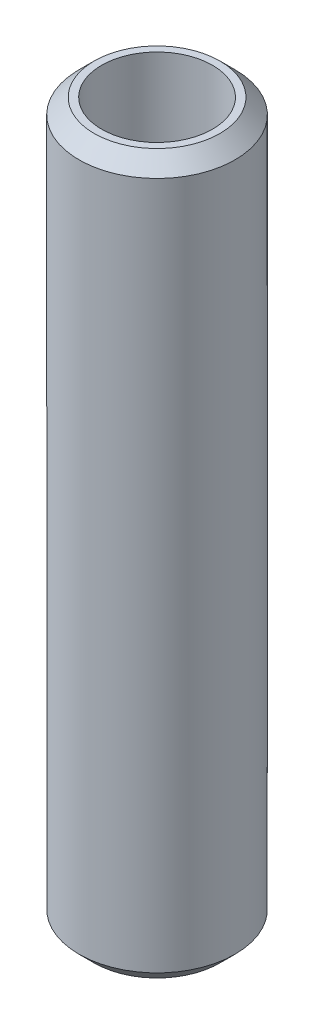
from build123d import *

# Parameters (mm, degrees)
SKETCH1_R           = 15
BOSS_EXTRUDE1_DEPTH = 138.051908772
SKETCH2_R           = 10.65749531
CUT_EXTRUDE1_DEPTH  = 140.672221703
CHAMFER1_SIZE       = 2.919359512


with BuildPart() as part:
    # Sketch1 → Boss-Extrude1 (new body)
    with BuildSketch(Plane(origin=(0, 0, 0), x_dir=(1, 0, 0), z_dir=(0, 1, 0))):
        Circle(SKETCH1_R)
    extrude(amount=BOSS_EXTRUDE1_DEPTH)

    # Sketch2 → Cut-Extrude1 (cut, through all)
    with BuildSketch(Plane(origin=(0, 0, 0), x_dir=(1, 0, 0), z_dir=(0, 1, 0))):
        Circle(SKETCH2_R)
    extrude(amount=CUT_EXTRUDE1_DEPTH, mode=Mode.SUBTRACT)

    # Chamfer1
    chamfer1_edges = [part.edges().sort_by_distance(p)[0] for p in [
        (-15, 138.051908772, 0),
        (-15, 0, 0),
    ]]
    chamfer(chamfer1_edges, length=CHAMFER1_SIZE)


solid = part.part
